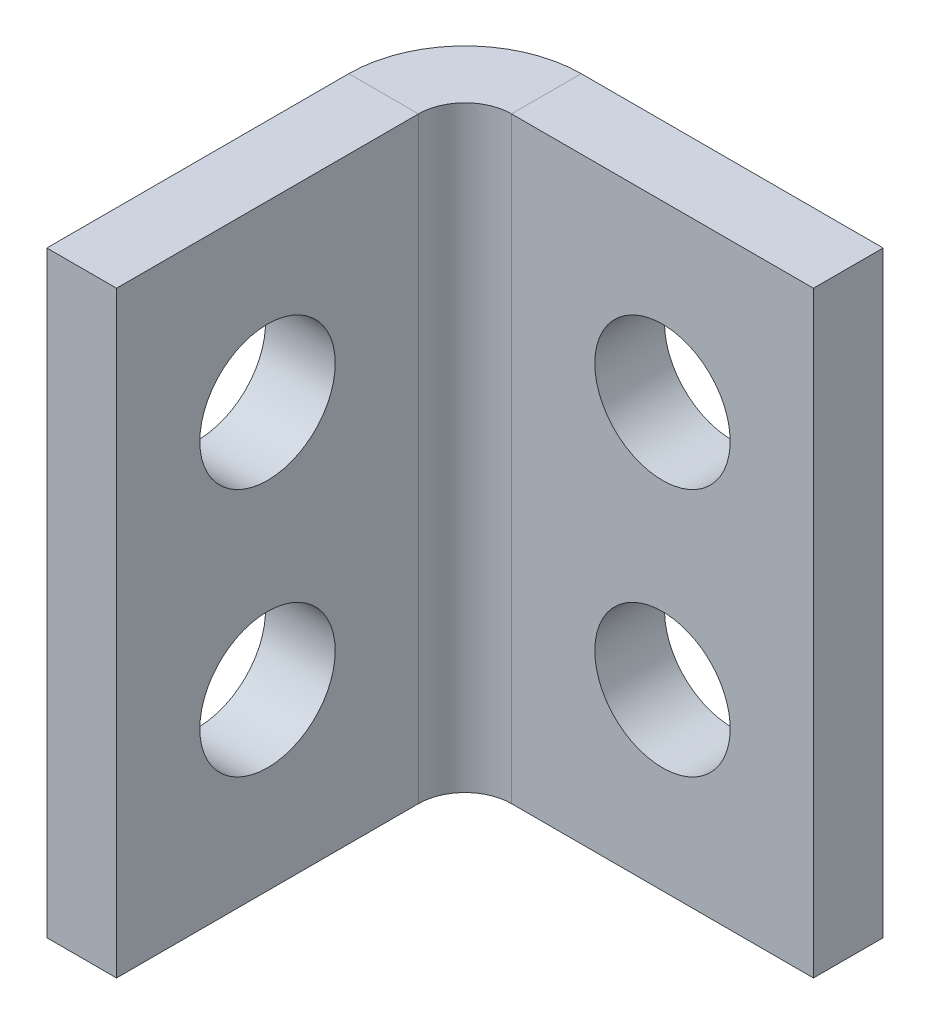
from build123d import *

# Parameters (mm, degrees)
SKETCH1_W                      = 8.75
SKETCH1_H                      = 15
BASE_FLANGE1_DEPTH             = 1.75
EDGE_FLANGE1_STRIP_W           = 9.3368
EDGE_FLANGE1_STRIP_H           = 1.75
EDGE_FLANGE1_STRIP_CUT_DEPTH   = 15
EDGE_FLANGE1_DEPTH             = 15
M3_CLEARANCE_HOLE1_D           = 3.4
M3_CLEARANCE_HOLE1_ON_FACE_2_D = 3.4


# Sheet-metal steps are written as plain solids
with BuildPart() as part:
    # Sketch1 → Base-Flange1 (new body)
    with BuildSketch(Plane.XY):
        with Locations((4.375, 7.5)):
            Rectangle(SKETCH1_W, SKETCH1_H)
    extrude(amount=-BASE_FLANGE1_DEPTH)

    # Edge-Flange1 strip (across the edge) → Edge-Flange1 strip cut (cut)
    with BuildSketch(Plane.XZ.offset(-15)):
        with Locations((-3.5, -0.875)):
            Rectangle(EDGE_FLANGE1_STRIP_W, EDGE_FLANGE1_STRIP_H)
    extrude(amount=EDGE_FLANGE1_STRIP_CUT_DEPTH, mode=Mode.SUBTRACT)

    # Edge-Flange1 section (across the edge) → Edge-Flange1 (add)
    with BuildSketch(Plane.XZ.offset(-15)):
        with BuildLine():
            Line((-1.75, 1.1684), (-1.75, 8.75))
            Line((-1.75, 8.75), (0, 8.75))
            Line((0, 8.75), (0, 1.1684))
            ThreePointArc((0, 1.1684), (0.342216437, 0.342216437), (1.1684, 0))
            Line((1.1684, 0), (1.1684, -1.75))
            ThreePointArc((1.1684, -1.75), (-0.89522043, -0.89522043), (-1.75, 1.1684))
        make_face()
    extrude(amount=EDGE_FLANGE1_DEPTH)

    # M3 Clearance Hole1 (through all)
    with Locations(Plane(origin=(-1.75, 10.625, 4.9592), x_dir=(0, 0, -1), z_dir=(-1, 0, 0))):
        with Locations((0, 0), (0, 6.25)):
            Hole(M3_CLEARANCE_HOLE1_D / 2)

    # M3 Clearance Hole1 on face 2 (through all)
    with Locations(Plane(origin=(4.9592, 10.625, -1.75), x_dir=(-1, 0, 0), z_dir=(0, 0, -1))):
        with Locations((0, 0), (0, -6.25)):
            Hole(M3_CLEARANCE_HOLE1_ON_FACE_2_D / 2)


solid = part.part
